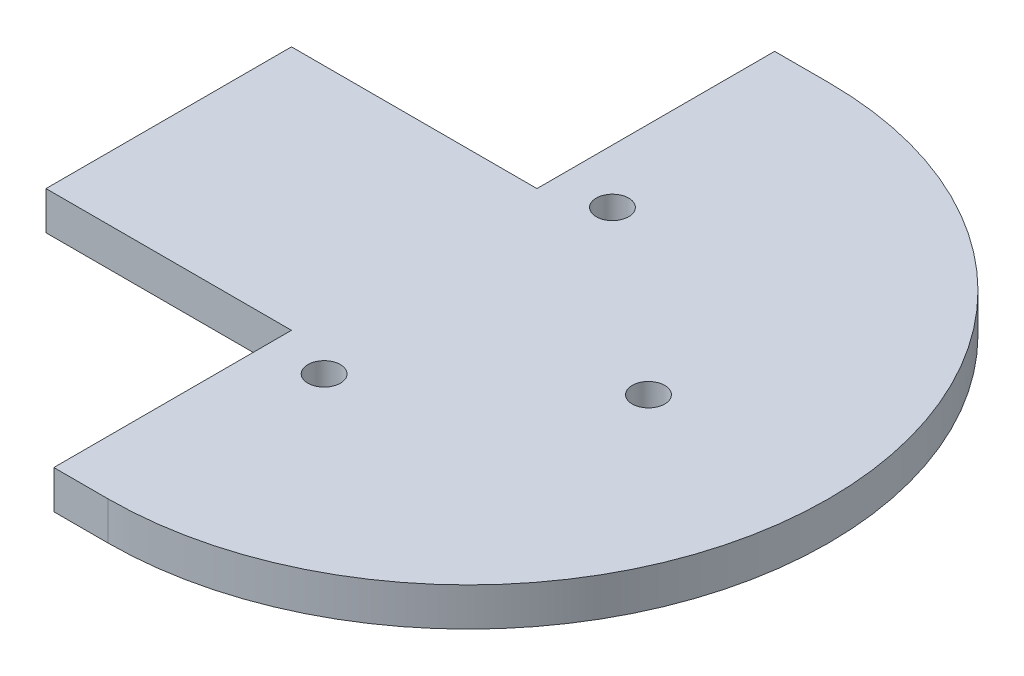
from build123d import *

# Parameters (mm, degrees)
SKETCH1_R           = 1.143
BOSS_EXTRUDE1_DEPTH = 2.7


with BuildPart() as part:
    # Sketch1 → Boss-Extrude1 (new body)
    with BuildSketch(Plane(origin=(0, 0, 0), x_dir=(1, 0, 0), z_dir=(0, 1, 0))):
        with BuildLine():
            Line((-14.121327339, -33.908852397), (-14.121327339, -50.658852397))
            Line((-14.121327339, -50.658852397), (-10.311327339, -50.658852397))
            ThreePointArc((-10.311327339, -50.658852397), (15.088672661, -25.258852397), (-10.311327339, 0.141147603))
            Line((-10.311327339, 0.141147603), (-14.121327339, 0.141147603))
            Line((-14.121327339, 0.141147603), (-14.121327339, -16.608852397))
            Line((-14.121327339, -16.608852397), (-31.421327339, -16.608852397))
            Line((-31.421327339, -16.608852397), (-31.421327339, -33.908852397))
            Line((-31.421327339, -33.908852397), (-14.121327339, -33.908852397))
        make_face()
        with Locations((-10.311327339, -15.098852397)):
            Circle(SKETCH1_R, mode=Mode.SUBTRACT)
        with Locations((-10.311327339, -35.418852397)):
            Circle(SKETCH1_R, mode=Mode.SUBTRACT)
        with Locations((2.388672661, -25.258852397)):
            Circle(SKETCH1_R, mode=Mode.SUBTRACT)
    extrude(amount=BOSS_EXTRUDE1_DEPTH)


solid = part.part
